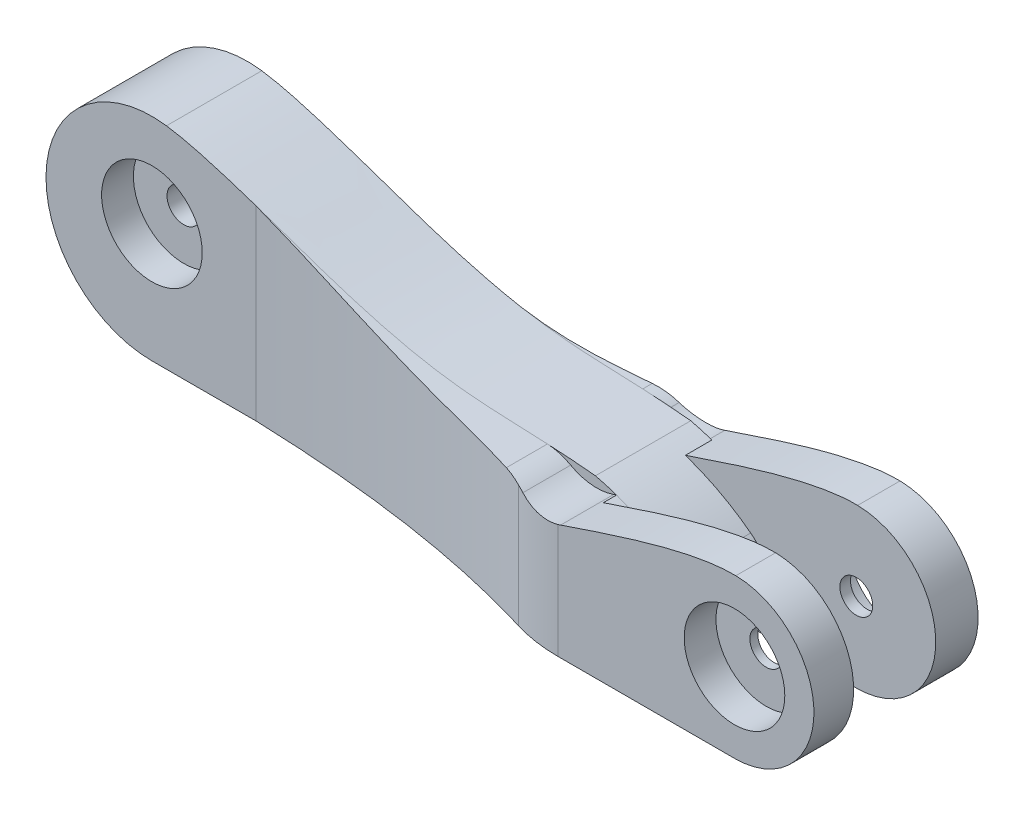
from build123d import *

# Parameters (mm, degrees)
BOSS_EXTRUDE1_DEPTH     = 9
SKETCH2_R               = 3.1
BOSS_EXTRUDE2_DEPTH     = 10
CUT_EXTRUDE2_DEPTH      = 2.5
BOSS_EXTRUDE3_START     = 3
SKETCH5_R               = 3.1
BOSS_EXTRUDE3_DEPTH     = 8
SKETCH6_R               = 9.5
CUT_EXTRUDE3_DEPTH      = 6
CUT_EXTRUDE4_START      = -6
SKETCH7_R               = 9.5
CUT_EXTRUDE4_DEPTH      = 6
CUT_EXTRUDE5_DEPTH      = 143.358702014
CUT_EXTRUDE5_DEPTH_BACK = 143.358702014
SKETCH9_R               = 3.15
SKETCH10_R              = 9.5
CUT_EXTRUDE6_DEPTH      = 6
CUT_EXTRUDE7_START      = -6
SKETCH11_R              = 9.5
CUT_EXTRUDE7_DEPTH      = 6
CUT_EXTRUDE9_DEPTH      = 143.077443807
CUT_EXTRUDE9_DEPTH_BACK = 13
SKETCH14_R              = 4
CUT_EXTRUDE10_DEPTH     = 21.66124162
BOSS_EXTRUDE4_DEPTH     = 50
CUT_EXTRUDE11_START     = -13
CUT_EXTRUDE11_DEPTH     = 33
FILLET1_R               = 10
FILLET2_R               = 10
FILLET3_R               = 30
FILLET4_R               = 10
SKETCH16_R              = 1.4
CUT_EXTRUDE12_DEPTH     = 7
FILLET5_R               = 8.5


with BuildPart() as part:
    # Sketch1 → Boss-Extrude1 (new, symmetric)
    with BuildSketch(Plane.XY):
        with BuildLine():
            Line((104, 0), (104, 12))
            add(Edge.make_bspline(
                [(83.742427574, 23.082272739), (95.432975049, 20.247819963), (104, 12)],
                knots=[0, 0, 0, 1, 1, 1], degree=2))
            add(Edge.make_bspline(
                [(2.744648325, 39.810777511), (10.655243639, 38.714818396), (55.694198374, 21.26683616), (64.669620814, 25.013647462), (83.742427574, 23.082272739)],
                knots=[0, 0, 0, 0, 0.279667256, 1, 1, 1, 1], degree=3))
            ThreePointArc((2.744648325, 39.810777511), (-19.952638299, 21.375581657), (0, 0))
            Line((0, 0), (104, 0))
        make_face()
    extrude(amount=BOSS_EXTRUDE1_DEPTH, both=True)

    # Sketch2 → Boss-Extrude2 (add)
    with BuildSketch(Plane.XY.offset(9)):
        with BuildLine():
            Line((120, 0), (82, 0))
            Line((82, 0), (82, 20))
            add(Edge.make_bspline(
                [(82, 20), (92.875054565, 23.577214891), (110.461797596, 30.164592894), (120.25538588, 29.997825778)],
                knots=[0, 0, 0, 0, 1, 1, 1, 1], degree=3))
            ThreePointArc((120.25538588, 29.997825778), (134.999456435, 14.872302433), (120, 0))
        make_face()
        with Locations((120, 15)):
            Circle(SKETCH2_R, mode=Mode.SUBTRACT)
    extrude(amount=BOSS_EXTRUDE2_DEPTH)

    # Sketch3 → Cut-Extrude2 (cut)
    with BuildSketch(Plane(origin=(0, 0, 9), x_dir=(-1, 0, 0), z_dir=(0, 0, -1))):
        with BuildLine():
            Line((-120, 0), (-104, 0))
            Line((-104, 0), (-104.000000043, 11.999999959))
            add(Edge.make_bspline(
                [(-104.000000043, 11.999999959), (-96.929384576, 18.807166261), (-87.731124843, 21.926918893)],
                knots=[0, 0, 0, 1, 1, 1], degree=2))
            add(Edge.make_bspline(
                [(-87.731124843, 21.926918893), (-98.350669213, 25.528222483), (-112.042970173, 30.137668381), (-120.25538588, 29.997825778)],
                knots=[0, 0, 0, 0, 0.83855023, 0.83855023, 0.83855023, 0.83855023], degree=3))
            ThreePointArc((-120.25538588, 29.997825778), (-134.999456435, 14.872302433), (-120, 0))
        make_face()
    extrude(amount=-CUT_EXTRUDE2_DEPTH, mode=Mode.SUBTRACT)

    # Sketch5 → Boss-Extrude3 (add)
    with BuildSketch(Plane(origin=(0, 0, -9), x_dir=(-1, 0, 0), z_dir=(0, 0, -1)).offset(BOSS_EXTRUDE3_START)):
        with BuildLine():
            Line((-120, 0), (-82, 0))
            Line((-82, 0), (-82, 20))
            add(Edge.make_bspline(
                [(-82, 20), (-92.875054565, 23.577214891), (-110.461797596, 30.164592894), (-120.25538588, 29.997825778)],
                knots=[0, 0, 0, 0, 1, 1, 1, 1], degree=3))
            ThreePointArc((-120.25538588, 29.997825778), (-134.999456435, 14.872302433), (-120, 0))
        make_face()
        with Locations((-120, 15)):
            Circle(SKETCH5_R, mode=Mode.SUBTRACT)
    extrude(amount=-BOSS_EXTRUDE3_DEPTH)

    # Sketch6 → Cut-Extrude3 (cut)
    with BuildSketch(Plane(origin=(0, 0, -12), x_dir=(-1, 0, 0), z_dir=(0, 0, -1))):
        with Locations((-120, 15)):
            Circle(SKETCH6_R)
    extrude(amount=-CUT_EXTRUDE3_DEPTH, mode=Mode.SUBTRACT)

    # Sketch7 → Cut-Extrude4 (cut)
    with BuildSketch(Plane.XY.offset(19).offset(CUT_EXTRUDE4_START)):
        with Locations(Location((120, 15, 0), (0, 0, 180))):
            Circle(SKETCH7_R)
    extrude(amount=CUT_EXTRUDE4_DEPTH, mode=Mode.SUBTRACT)

    # Sketch9 → Cut-Extrude5 (cut, two sides: drawn at the far end of the back side and taken through both)
    with BuildSketch(Plane.XY.offset(9).offset(-CUT_EXTRUDE5_DEPTH_BACK)):
        with Locations((0, 22.425142051)):
            Circle(SKETCH9_R)
    extrude(amount=CUT_EXTRUDE5_DEPTH + CUT_EXTRUDE5_DEPTH_BACK, mode=Mode.SUBTRACT)

    # Sketch10 → Cut-Extrude6 (cut)
    with BuildSketch(Plane.XY.offset(9)):
        with Locations((0, 22.425142051)):
            Circle(SKETCH10_R)
    extrude(amount=-CUT_EXTRUDE6_DEPTH, mode=Mode.SUBTRACT)

    # Sketch11 → Cut-Extrude7 (cut)
    with BuildSketch(Plane(origin=(0, 0, -9), x_dir=(-1, 0, 0), z_dir=(0, 0, -1)).offset(CUT_EXTRUDE7_START)):
        with Locations(Location((0, 22.425142051, 0), (0, 0, 180))):
            Circle(SKETCH11_R)
    extrude(amount=CUT_EXTRUDE7_DEPTH, mode=Mode.SUBTRACT)

    # Sketch13 → Cut-Extrude9 (cut, two sides: drawn at the far end of the back side and taken through both)
    with BuildSketch(Plane.XZ.offset(-CUT_EXTRUDE9_DEPTH_BACK)):
        with BuildLine():
            Line((31.5, 5), (86.5, 5))
            ThreePointArc((86.5, 5), (91.5, 0), (86.5, -5))
            Line((86.5, -5), (31.5, -5))
            ThreePointArc((31.5, -5), (26.5, 0), (31.5, 5))
        make_face()
    extrude(amount=CUT_EXTRUDE9_DEPTH + CUT_EXTRUDE9_DEPTH_BACK, mode=Mode.SUBTRACT)

    # Sketch14 → Cut-Extrude10 (cut)
    with BuildSketch(Plane(origin=(104, 0, 0), x_dir=(0, 0, -1), z_dir=(1, 0, 0))):
        with Locations(Location((-3.969491807, 11.999999959, 0), (0, 0, 14.477512794))):
            Circle(SKETCH14_R)
    extrude(amount=-CUT_EXTRUDE10_DEPTH, mode=Mode.SUBTRACT)

    # Sketch8 → Boss-Extrude4 (add)
    with BuildSketch(Plane.XZ):
        with BuildLine():
            Line((82, 9), (82, 19))
            add(Edge.make_bspline(
                [(19.699347718, 9), (40.732394313, 9.734317033), (61.957307871, 12.332191619), (82, 19)],
                knots=[0, 0, 0, 0, 1, 1, 1, 1], degree=3))
            Line((19.699347718, 9), (82, 9))
        make_face()
        with BuildLine():
            Line((51.782581508, -9), (82, -9))
            Line((82, -9), (82, -12))
            add(Edge.make_bspline(
                [(51.782581508, -9), (67.046692254, -9.204975349), (82, -12)],
                knots=[0, 0, 0, 1, 1, 1], degree=2))
        make_face()
    extrude(amount=-BOSS_EXTRUDE4_DEPTH)

    # Cut-Extrude11: read off the stored shape, not the designer's step
    # Cut-Extrude11 outline → Cut-Extrude11 (cut)
    with BuildSketch(Plane.XY.offset(CUT_EXTRUDE11_START)):
        with BuildLine():
            Line((19.699347718, 50), (19.699347718, 35.171879438))
            add(Edge.make_bspline(
                [(19.699347718, 35.171879438), (24.267884132, 33.629898012), (37.542937569, 28.882316465), (46.684652576, 26.56392721), (51.782581508, 25.6363415)],
                knots=[0.161572376, 0.161572376, 0.161572376, 0.161572376, 0.279667256, 0.500117335, 0.500117335, 0.500117335, 0.500117335], degree=3))
            Line((51.782581508, 25.6363415), (51.782581508, 50))
            Line((51.782581508, 50), (19.699347718, 50))
        make_face()
        with BuildLine():
            Line((51.782581508, 50), (51.782581508, 25.6363415))
            add(Edge.make_bspline(
                [(51.782581508, 25.6363415), (62.824790926, 23.627173501), (69.85623668, 24.34890497), (82, 23.249375576)],
                knots=[0.500117335, 0.500117335, 0.500117335, 0.500117335, 0.97761633, 0.97761633, 0.97761633, 0.97761633], degree=3))
            Line((82, 23.249375576), (82, 50))
            Line((82, 50), (51.782581508, 50))
        make_face()
    extrude(amount=CUT_EXTRUDE11_DEPTH, mode=Mode.SUBTRACT)

    # Fillet1
    # the kernel refuses this fillet: 10 mm, written as the material it takes off along each edge
    with BuildSketch(Plane(origin=(82, 23.249375576, -30.339920356), x_dir=(0, -1, 0), z_dir=(0, 0, 1))) as fillet1_piece_1:
        with BuildLine():
            CenterArc((9.48019947, -7.821562095), FILLET1_R, 128.541577935, 48.574401374)
            Line((-0.507134813, -7.318418058), (-0.706881499, -7.308355177))
            ThreePointArc((-0.706881499, -7.308355177), (-0.490218429, -3.642941383), (-0.199185208, 0.018034771))
            Line((-0.199185208, 0.018034771), (0, 0.2))
            ThreePointArc((0, 0.2), (1.624687788, 0.2), (3.124759098, 0.156431242))
            Line((3.124759098, 0.156431242), (3.249375576, 0))
        make_face()
    extrude(amount=21.339920356, mode=Mode.SUBTRACT)
    with BuildSketch(Plane(origin=(82, 23.249375576, -30.339920356), x_dir=(0, -1, 0), z_dir=(0, 0, 1))) as fillet1_piece_2_section:
        with BuildLine():
            CenterArc((9.48019947, -7.821562095), FILLET1_R, 128.541577935, 48.574401374)
            Line((-0.507134813, -7.318418058), (-0.706881499, -7.308355177))
            ThreePointArc((-0.706881499, -7.308355177), (-0.490218429, -3.642941383), (-0.199185208, 0.018034771))
            Line((-0.199185208, 0.018034771), (0, 0.2))
            ThreePointArc((0, 0.2), (1.624687788, 0.2), (3.124759098, 0.156431242))
            Line((3.124759098, 0.156431242), (3.249375576, 0))
        make_face()
    fillet1_piece_2 = extrude(amount=39.679840711, mode=Mode.PRIVATE)
    fillet1_piece_2 = split(fillet1_piece_2, bisect_by=Plane(origin=(82, 23.249375576, 9), z_dir=(0, 0, 1)), keep=Keep.TOP, mode=Mode.PRIVATE)
    add(fillet1_piece_2, mode=Mode.SUBTRACT)
    with BuildSketch(Plane(origin=(82, 23.249375576, -9.339920356), x_dir=(0, -1, 0), z_dir=(0, 0, 1))) as fillet1_piece_3_section:
        with BuildLine():
            CenterArc((9.48019947, -7.821562095), FILLET1_R, 128.541577935, 48.574401374)
            Line((-0.507134813, -7.318418058), (-0.706881499, -7.308355177))
            ThreePointArc((-0.706881499, -7.308355177), (-0.490218429, -3.642941383), (-0.199185208, 0.018034771))
            Line((-0.199185208, 0.018034771), (0, 0.2))
            ThreePointArc((0, 0.2), (1.624687788, 0.2), (3.124759098, 0.156431242))
            Line((3.124759098, 0.156431242), (3.249375576, 0))
        make_face()
    fillet1_piece_3 = extrude(amount=46.679840711, mode=Mode.PRIVATE)
    fillet1_piece_3 = split(fillet1_piece_3, bisect_by=Plane(origin=(82, 23.249375576, -9), z_dir=(0, 0, -1)), keep=Keep.TOP, mode=Mode.PRIVATE)
    add(fillet1_piece_3, mode=Mode.SUBTRACT)
    with BuildSketch(Plane(origin=(82, 23.249375576, 9), x_dir=(0, -1, 0), z_dir=(0, 0, 1))) as fillet1_piece_4:
        with BuildLine():
            CenterArc((9.48019947, -7.821562095), FILLET1_R, 128.541577935, 48.574401374)
            Line((-0.507134813, -7.318418058), (-0.706881499, -7.308355177))
            ThreePointArc((-0.706881499, -7.308355177), (-0.490218429, -3.642941383), (-0.199185208, 0.018034771))
            Line((-0.199185208, 0.018034771), (0, 0.2))
            ThreePointArc((0, 0.2), (1.624687788, 0.2), (3.124759098, 0.156431242))
            Line((3.124759098, 0.156431242), (3.249375576, 0))
        make_face()
    extrude(amount=28.339920356, mode=Mode.SUBTRACT)

    # Fillet2
    fillet2_edges = [part.edges().sort_by_distance(p)[0] for p in [
        (82, 20, -10.5),
        (82, 20, 14),
    ]]
    fillet(fillet2_edges, radius=FILLET2_R)

    # Fillet3
    fillet3_edges = [part.edges().sort_by_distance(p)[0] for p in [
        (82, 10.702652104, 19),
        (82, 10.702652104, -12),
    ]]
    fillet(fillet3_edges, radius=FILLET3_R)

    # Fillet4
    # the kernel refuses this fillet: 10 mm, written as the material it takes off along each edge
    with BuildSketch(Plane(origin=(104.000000043, 11.999999959, 9), x_dir=(-0.7588247945294118, 0.6512948112854854, 0), z_dir=(0, 0, 1))) as fillet4_piece_1:
        with BuildLine():
            CenterArc((4.609954623, 9.98296322), FILLET4_R, 220.639296174, 52.705680264)
            Line((-2.978293345, 3.470015134), (-3.130058305, 3.339756173))
            Line((-3.130058305, 3.339756173), (-0.151764959, -0.130258962))
            Line((-0.151764959, -0.130258962), (-0.011419265, -0.199673735))
            ThreePointArc((-0.011419265, -0.199673735), (2.596629175, -0.275057919), (5.205101106, -0.199659264))
            Line((5.205101106, -0.199659264), (5.193431567, 0))
        make_face()
    extrude(amount=2.5, mode=Mode.SUBTRACT)
    with BuildSketch(Plane(origin=(104, 12, 12.953070685), x_dir=(0, -1, 0), z_dir=(0, 0, -1))) as fillet4_piece_2_section:
        with BuildLine():
            CenterArc((4.572880509, 10), FILLET4_R, 217.294319884, 52.705680116)
            Line((-3.382455018, 3.940904634), (-3.541561728, 3.819722726))
            ThreePointArc((-3.541561728, 3.819722726), (-1.89989187, 1.791242801), (-0.144080073, -0.138711689))
            Line((-0.144080073, -0.138711689), (0, -0.2))
            Line((0, -0.2), (4.572880509, -0.2))
            Line((4.572880509, -0.2), (4.572880509, 0))
        make_face()
    fillet4_piece_2 = extrude(amount=16.953070685, mode=Mode.PRIVATE)
    fillet4_piece_2 = split(fillet4_piece_2, bisect_by=Plane(origin=(104, 12, 11.5), z_dir=(0, 0, -1)), keep=Keep.TOP, mode=Mode.PRIVATE)
    add(fillet4_piece_2, mode=Mode.SUBTRACT)
    with BuildSketch(Plane(origin=(104, 12, -5.014087071), x_dir=(-0.7588247952695827, 0.6512948104231108, 0), z_dir=(0, 0, 1))) as fillet4_piece_3_section:
        with BuildLine():
            CenterArc((4.609954608, 9.98296322), FILLET4_R, 220.639296313, 52.705680116)
            Line((-2.978293344, 3.470015116), (-3.130058303, 3.339756154))
            Line((-3.130058303, 3.339756154), (-0.151764959, -0.130258962))
            Line((-0.151764959, -0.130258962), (-0.011419265, -0.199673735))
            ThreePointArc((-0.011419265, -0.199673735), (2.596629167, -0.275057919), (5.20510109, -0.199659264))
            Line((5.20510109, -0.199659264), (5.193431551, 0))
        make_face()
    fillet4_piece_3 = extrude(amount=14.014087071, mode=Mode.PRIVATE)
    fillet4_piece_3 = split(fillet4_piece_3, bisect_by=Plane(origin=(104, 12, -4), z_dir=(0, 0, 1)), keep=Keep.TOP, mode=Mode.PRIVATE)
    add(fillet4_piece_3, mode=Mode.SUBTRACT)

    # Sketch16 → Cut-Extrude12 (cut)
    with BuildSketch(Plane(origin=(0, 0, -9), x_dir=(-1, 0, 0), z_dir=(0, 0, -1))):
        with Locations((0, 35.831448738)):
            Circle(SKETCH16_R)
        with Locations((13.5, 22.331448738)):
            Circle(SKETCH16_R)
        with Locations((0, 8.831448738)):
            Circle(SKETCH16_R)
        with Locations((-13.5, 22.331448738)):
            Circle(SKETCH16_R)
    extrude(amount=-CUT_EXTRUDE12_DEPTH, mode=Mode.SUBTRACT)

    # Fillet5
    # the kernel refuses this fillet: 8.5 mm, written as the material it takes off along each edge
    with BuildSketch(Plane(origin=(104, 0, -4), x_dir=(-1, 0, 0), z_dir=(0, 0, 1))) as fillet5_piece_1:
        with BuildLine():
            CenterArc((8.951702612, -8.5), FILLET5_R, 90, 135.663992415)
            Line((3.011350748, -14.579656218), (2.417315561, -15.18762184))
            ThreePointArc((2.417315561, -15.18762184), (-0.85, -7.427119491), (-0.85, 0))
            Line((-0.85, 0), (0, 0.85))
            Line((0, 0.85), (8.951702612, 0.85))
            Line((8.951702612, 0.85), (8.951702612, 0))
        make_face()
    extrude(amount=13, mode=Mode.SUBTRACT)
    with BuildSketch(Plane(origin=(104, 0, 9), x_dir=(-1, 0, 0), z_dir=(0, 0, 1))) as fillet5_piece_2:
        with BuildLine():
            CenterArc((8.951702612, -8.5), FILLET5_R, 90, 135.663992415)
            Line((3.011350748, -14.579656218), (2.417315561, -15.18762184))
            ThreePointArc((2.417315561, -15.18762184), (-0.85, -7.427119431), (-0.85, 3e-09))
            Line((-0.85, 3e-09), (0, 0.85))
            Line((0, 0.85), (8.951702612, 0.85))
            Line((8.951702612, 0.85), (8.951702612, 0))
        make_face()
    extrude(amount=2.5, mode=Mode.SUBTRACT)


solid = part.part
